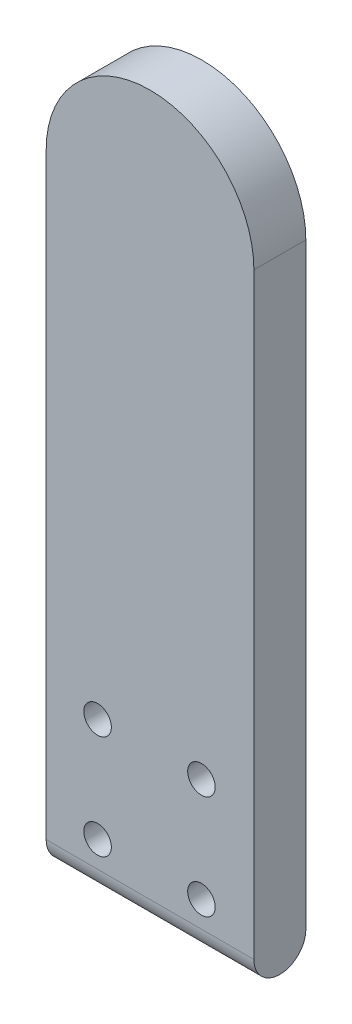
from build123d import *

# Parameters (mm, degrees)
SKETCH1_W           = 40
SKETCH1_H           = 10
BOSS_EXTRUDE1_DEPTH = 140
FILLET4_RADIUS      = 20
FILLET4_LENGTH      = 10
SKETCH2_R           = 2.65
CUT_EXTRUDE1_DEPTH  = 10
FILLET5_R           = 5


with BuildPart() as part:
    # Sketch1 → Boss-Extrude1 (new body)
    with BuildSketch(Plane(origin=(0, 0, 0), x_dir=(1, 0, 0), z_dir=(0, 1, 0))):
        with Locations((-15.258586642, -11.19989116)):
            Rectangle(SKETCH1_W, SKETCH1_H)
    extrude(amount=BOSS_EXTRUDE1_DEPTH)

    # Fillet4: full round fillet: the end face becomes a half cylinder, R = half its width
    fillet4_face = Plane((-15.258586642, 140, 11.19989116), x_dir=(0, 0, -1), z_dir=(0, 1, 0))  # on the end face: x along it, z out of the body
    fillet4_slab = fillet4_face.offset(-FILLET4_RADIUS / 2) * Box(FILLET4_LENGTH, 2 * FILLET4_RADIUS, FILLET4_RADIUS, mode=Mode.PRIVATE)  # the body's end, R deep
    fillet4_round = Plane((-15.258586642, 120, 11.19989116), x_dir=(0, 1, 0), z_dir=(0, 0, -1)) * Cylinder(FILLET4_RADIUS, FILLET4_LENGTH, mode=Mode.PRIVATE)  # its axis R under the face
    add(fillet4_slab - fillet4_round, mode=Mode.SUBTRACT)

    # Sketch2 → Cut-Extrude1 (cut)
    with BuildSketch(Plane(origin=(0, 0, 6.19989116), x_dir=(-1, 0, 0), z_dir=(0, 0, -1))):
        with Locations((5.358586642, 10)):
            Circle(SKETCH2_R)
        with Locations((25.358586642, 10)):
            Circle(SKETCH2_R)
        with Locations((25.358586642, 30)):
            Circle(SKETCH2_R)
        with Locations((5.358586642, 30)):
            Circle(SKETCH2_R)
    extrude(amount=-CUT_EXTRUDE1_DEPTH, mode=Mode.SUBTRACT)

    # Fillet5
    fillet5_edges = [part.edges().sort_by_distance(p)[0] for p in [
        (-15.258586642, 0, 16.19989116),
        (-15.258586642, 0, 6.19989116),
    ]]
    fillet(fillet5_edges, radius=FILLET5_R - 0.0001)  # a hair under: the kernel refuses the full size


solid = part.part
